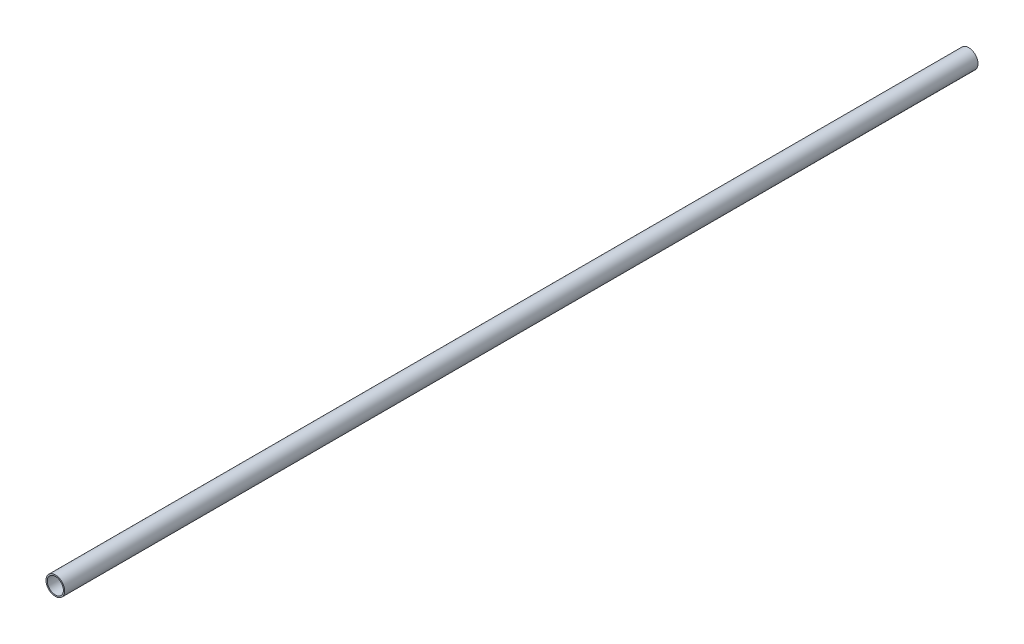
from build123d import *

# Parameters (mm, degrees)
SKETCH2_R           = 5.5245
SKETCH2_R_2         = 4.7625
BOSS_EXTRUDE1_DEPTH = 540.004


with BuildPart() as part:
    # Sketch2 → Boss-Extrude1 (new body)
    with BuildSketch(Plane(origin=(-549.704008553, -1576.7432843, 0), x_dir=(0.7832549151199641, -0.6217006819526723, 0), z_dir=(0, 0, -1))):
        with Locations((-549.704008553, -1576.7432843)):
            Circle(SKETCH2_R)
        with Locations((-549.704008553, -1576.7432843)):
            Circle(SKETCH2_R_2, mode=Mode.SUBTRACT)
    extrude(amount=BOSS_EXTRUDE1_DEPTH)


solid = part.part
